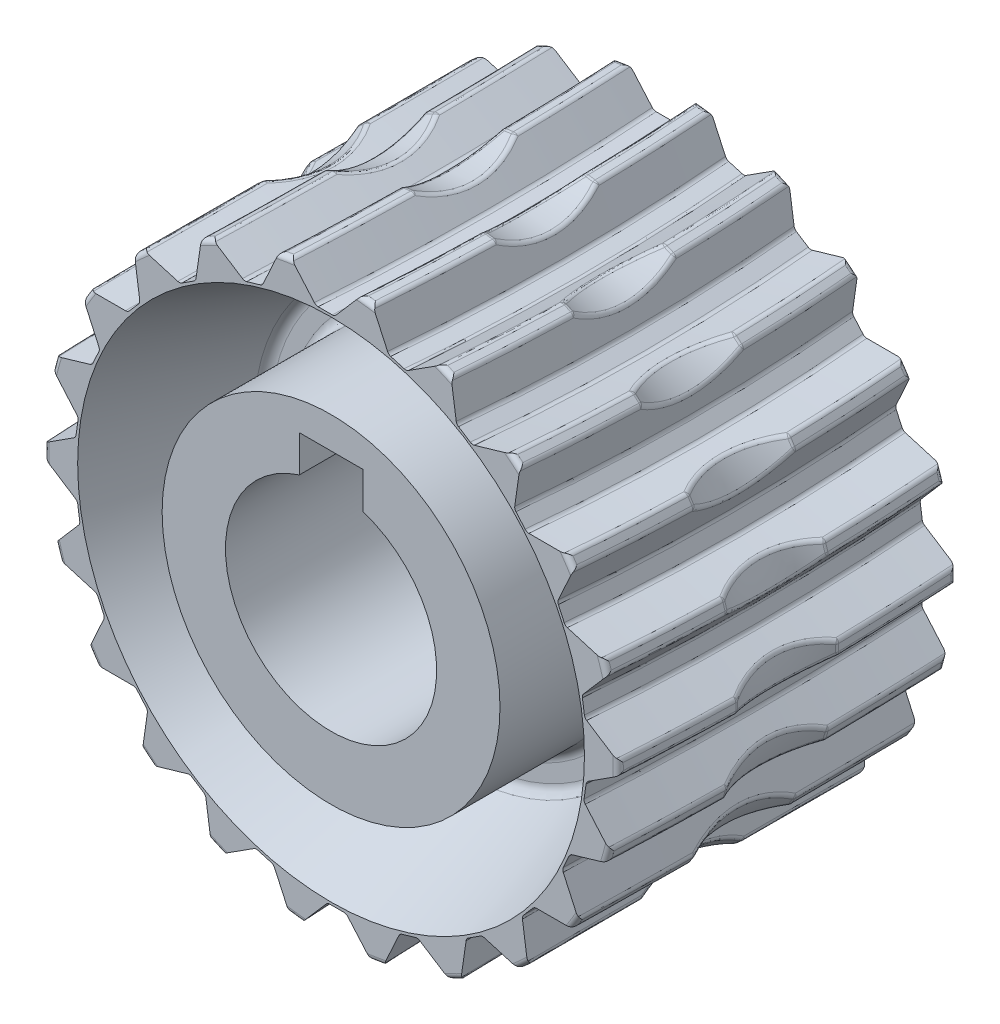
from build123d import *

# Parameters (mm, degrees)
SKETCH2_R                = 28.575
SKETCH2_R_2              = 7.9375
BOSS_EXTRUDE1_DEPTH      = 12.7
SKETCH3_R                = 7.9375
CHAMFER1_SIZE            = 2.54
FILLET1_R                = 0.7874
CUT_EXTRUDE1_DEPTH       = 43.359783404
CUT_EXTRUDE1_DEPTH_BACK  = 43.359783404
SKETCH5_W                = 4.7752
SKETCH5_H                = 10.3251
SKETCH9_W                = 25.4
SKETCH9_H                = 6.985
FILLET2_R                = 0.381
CIRPATTERN1_COUNT        = 22
FILLET2_OF_CIRPATTERN1_R = 0.381
FILLET3_R                = 0.381


with BuildPart() as part:
    # Sketch2 → Boss-Extrude1 (new, symmetric)
    with BuildSketch(Plane.XY):
        Circle(SKETCH2_R)
        Circle(SKETCH2_R_2, mode=Mode.SUBTRACT)
    extrude(amount=BOSS_EXTRUDE1_DEPTH, both=True)

    # Sketch3 → Cut-Revolve1 (revolve, cut)
    with BuildSketch(Plane(origin=(0, 0, 0), x_dir=(0, 0, -1), z_dir=(1, 0, 0))):
        with Locations((0, 28.575)):
            Circle(SKETCH3_R)
    revolve(axis=Axis((0, 0, 0), (0, 0, -1)), mode=Mode.SUBTRACT)

    # Sketch4 → Cut-Revolve2 (revolve, cut)
    with BuildSketch(Plane(origin=(0, 0, 0), x_dir=(0, 0, -1), z_dir=(1, 0, 0))):
        Polygon((12.7, 19.05), (2.54, 15.24), (2.54, 12.7), (12.7, 12.7), align=None)
        Polygon((-12.7, 12.7), (-12.7, 19.05), (-2.54, 15.24), (-2.54, 12.7), align=None)
    revolve(axis=Axis((0, 0, 0), (0, 0, -1)), mode=Mode.SUBTRACT)

    # Chamfer1
    chamfer1_edges = [part.edges().sort_by_distance(p)[0] for p in [
        (-28.575, 0, -12.7),
        (-28.575, 0, 12.7),
    ]]
    chamfer(chamfer1_edges, length=CHAMFER1_SIZE)

    # Fillet1
    fillet1_edges = [part.edges().sort_by_distance(p)[0] for p in [
        (0, -12.7, 2.54),
        (0, -12.7, -2.54),
        (0, -15.24, -2.54),
        (0, -15.24, 2.54),
    ]]
    fillet(fillet1_edges, radius=FILLET1_R)

    # Sketch5 → Cut-Extrude1 (cut, two sides: drawn at the far end of the back side and taken through both)
    with BuildSketch(Plane.XY.offset(-CUT_EXTRUDE1_DEPTH_BACK)):
        with Locations((0, 5.16255)):
            Rectangle(SKETCH5_W, SKETCH5_H)
    extrude(amount=CUT_EXTRUDE1_DEPTH + CUT_EXTRUDE1_DEPTH_BACK, mode=Mode.SUBTRACT)

    # Sketch9 → Cut-Revolve3 (revolve, cut)
    with BuildSketch(Plane(origin=(0, 0, 0), x_dir=(0, 0, -1), z_dir=(1, 0, 0))):
        with Locations((0, 25.0825)):
            Rectangle(SKETCH9_W, SKETCH9_H)
    revolve(axis=Axis((0, 0, -52.429787046), (0, 0, 1)), mode=Mode.SUBTRACT)

    # Cut-Sweep1: sweep along a path in Sketch7
    with BuildLine(Plane(origin=(0, 24.13, 0), x_dir=(1, 0, 0), z_dir=(0, 1, 0))) as cut_sweep1_path:
        ThreePointArc((-0.635, 15.24), (0, 0), (-0.635, -15.24))
    # Sketch12 → Cut-Sweep1 (sweep, cut)
    with BuildSketch(Plane(origin=(-0.635, 24.13, 15.24), x_dir=(0.9965337954939343, 0, 0.08318890814558023), z_dir=(-0.08318890814558023, 0, 0.9965337954939343))):
        Polygon((-0.6985, -4.9022), (0.6985, -4.9022), (4.950262732, 0), (-4.950262732, 0), align=None)
    cut_sweep1 = sweep(path=cut_sweep1_path.line, mode=Mode.SUBTRACT)

    # Fillet2
    fillet2_edges = [part.edges().sort_by_distance(p)[0] for p in [
        (-0.6985, 19.2278, 0),
        (0.6985, 19.2278, 0),
    ]]
    fillet(fillet2_edges, radius=FILLET2_R)

    # CirPattern1: Cut-Sweep1 ×22 about axis
    cirpattern1_axis = Axis((0, 0, -52.429787046), (0, 0, 1))
    for i in range(1, CIRPATTERN1_COUNT):
        add(cut_sweep1.rotate(cirpattern1_axis, i * 360 / CIRPATTERN1_COUNT), mode=Mode.SUBTRACT)

    # Fillet2 of CirPattern1
    fillet2_of_cirpattern1_edges = [part.edges().sort_by_distance(p)[0] for p in [
        (-6.087303099, 18.252148807, 0),
        (-4.746891414, 18.645729189, 0),
        (-10.982949103, 15.797817068, 0),
        (-9.807717917, 16.55309229, 0),
        (-14.988821888, 12.063640142, 0),
        (-14.073981443, 13.119422298, 0),
        (-17.780389467, 7.352138838, 0),
        (-17.200054694, 8.622894736, 0),
        (-19.131495635, 2.04501097, 0),
        (-18.932681806, 3.427791525, 0),
        (-18.932681806, -3.427791525, 0),
        (-19.131495635, -2.04501097, 0),
        (-17.200054694, -8.622894736, 0),
        (-17.780389467, -7.352138838, 0),
        (-14.073981443, -13.119422298, 0),
        (-14.988821888, -12.063640142, 0),
        (-9.807717917, -16.55309229, 0),
        (-10.982949103, -15.797817068, 0),
        (-4.746891414, -18.645729189, 0),
        (-6.087303099, -18.252148807, 0),
        (0.6985, -19.2278, 0),
        (-0.6985, -19.2278, 0),
        (6.087303099, -18.252148807, 0),
        (4.746891414, -18.645729189, 0),
        (10.982949103, -15.797817068, 0),
        (9.807717917, -16.55309229, 0),
        (14.988821888, -12.063640142, 0),
        (14.073981443, -13.119422298, 0),
        (17.780389467, -7.352138838, 0),
        (17.200054694, -8.622894736, 0),
        (19.131495635, -2.04501097, 0),
        (18.932681806, -3.427791525, 0),
        (18.932681806, 3.427791525, 0),
        (19.131495635, 2.04501097, 0),
        (17.200054694, 8.622894736, 0),
        (17.780389467, 7.352138838, 0),
        (14.073981443, 13.119422298, 0),
        (14.988821888, 12.063640142, 0),
        (9.807717917, 16.55309229, 0),
        (10.982949103, 15.797817068, 0),
        (4.746891414, 18.645729189, 0),
        (6.087303099, 18.252148807, 0),
    ]]
    fillet(fillet2_of_cirpattern1_edges, radius=FILLET2_OF_CIRPATTERN1_R)

    # Fillet3
    fillet3_edges = [part.edges().sort_by_distance(p)[0] for p in [
        (-14.611097653, 15.89477659, 8.237078233),
        (-14.61109766, 15.894776662, -8.237078232),
        (-14.439452275, 16.050866581, -12.7),
        (-13.913487952, 16.508874978, -8.237095845),
        (-13.913487999, 16.508874997, 8.237095846),
        (-18.497321584, 11.134504556, 8.237078233),
        (-18.497321611, 11.134504622, -8.237078232),
        (-18.376604682, 11.332629896, -12.7),
        (-18.000981487, 11.920267008, -8.237095845),
        (-18.000981537, 11.920267013, 8.237095846),
        (-20.885002528, 5.472181181, 8.237078233),
        (-20.885002573, 5.472181238, -8.237078232),
        (-20.824993868, 5.696290934, -12.7),
        (-20.630142557, 6.365949898, -8.237095845),
        (-20.630142606, 6.365949889, 8.237095846),
        (-21.580704775, -0.633465768, 8.237078233),
        (-21.580704834, -0.633465727, -8.237078232),
        (-21.586265901, -0.401527642, -12.7),
        (-21.58797217, 0.295901387, -8.237095845),
        (-21.587972214, 0.295901364, 8.237095846),
        (-20.528066667, -6.687793088, 8.237078233),
        (-20.528066735, -6.687793065, -8.237078232),
        (-20.59874705, -6.466816836, -12.7),
        (-20.796872666, -5.798119295, -8.237095845),
        (-20.796872702, -5.798119329, 8.237095846),
        (-19.465189627, -6.856588003, 0),
        (-20.705464522, -6.116521798, -3.770103613),
        (-20.082110884, -4.755547151, 0),
        (-20.705464522, -6.116521798, 3.770103613),
        (-20.59874705, -6.466816836, 12.7),
        (-20.608436746, -1.094870369, 0),
        (-21.58997105, -0.035356228, -3.770103613),
        (-20.608436746, 1.094870369, 0),
        (-21.58997105, -0.035356228, 3.770103613),
        (-21.586265901, -0.401527642, 12.7),
        (-20.082110884, 4.755547151, 0),
        (-20.725386524, 6.048673694, -3.770103613),
        (-19.465189627, 6.856588003, 0),
        (-20.725386524, 6.048673694, 3.770103613),
        (-20.824993868, 5.696290934, 12.7),
        (-17.92885183, 10.220698523, 0),
        (-18.18175444, 11.642676045, -3.770103613),
        (-16.744988608, 12.062825655, 0),
        (-18.18175444, 11.642676045, 3.770103613),
        (-18.376604682, 11.332629896, 12.7),
        (-14.323103828, 14.857829686, 0),
        (-14.165144742, 16.293458026, -3.770103613),
        (-12.668208198, 16.291804912, 0),
        (-14.165144742, 16.293458026, 3.770103613),
        (-14.439452275, 16.050866581, 12.7),
        (-9.541169485, 19.367348356, 8.237078233),
        (-9.541169472, 19.367348426, -8.237078232),
        (-9.33250132, 19.468757513, -12.7),
        (-8.698806371, 19.760032079, -8.237095845),
        (-8.69880641, 19.76003211, 8.237095846),
        (-9.556983137, 18.29126785, 0),
        (-9.000959261, 19.624240938, -3.770103613),
        (-7.565124901, 19.200919027, 0),
        (-9.000959261, 19.624240938, 3.770103613),
        (-9.33250132, 19.468757513, 12.7),
        (-17.812366683, -12.200315186, 8.237078233),
        (-17.812366754, -12.200315183, -8.237078232),
        (-18.320934247, -11.422410877, -8.237095846),
        (-18.320934247, -11.422410877, 8.237095846),
        (-17.942440218, -12.00820299, 12.7),
        (-18.143524399, -11.702163149, 3.770103613),
        (-16.744988608, -12.062825655, 0),
        (-17.92885183, -10.220698523, 0),
        (-17.942440218, -12.00820299, -12.7),
        (-18.143524399, -11.702163149, -3.770103613),
        (-13.653614684, -16.724440306, 8.237078233),
        (-13.653614754, -16.724440323, -8.237078232),
        (-14.360742659, -16.121326628, -8.237095846),
        (-14.360742659, -16.121326628, 8.237095846),
        (-13.832543587, -16.576755953, 12.7),
        (-14.111703833, -16.339764837, 3.770103613),
        (-12.668208198, -16.291804912, 0),
        (-14.323103828, -14.857829686, 0),
        (-13.832543587, -16.576755953, -12.7),
        (-14.111703833, -16.339764837, -3.770103613),
        (-8.388728024, -19.893650736, 8.237078233),
        (-8.388728086, -19.893650773, -8.237078232),
        (-8.60201654, -19.802358734, -12.7),
        (-9.237129106, -19.514188372, -8.237095846),
        (-9.237129106, -19.514188372, 8.237095846),
        (-7.565124901, -19.200919027, 0),
        (-8.936636948, -19.653615954, -3.770103613),
        (-9.556983137, -18.291267851, 0),
        (-8.936636948, -19.653615954, 3.770103613),
        (-8.60201654, -19.802358734, 12.7),
        (-2.44423651, -21.451195896, 8.237078233),
        (-2.444236559, -21.451195948, -8.237078232),
        (-3.365178289, -21.32612663, -8.237095846),
        (-3.365178289, -21.32612663, 8.237095846),
        (-2.674605271, -21.42369218, 12.7),
        (-3.037576886, -21.375247991, 3.770103613),
        (-1.849160176, -20.554488875, 0),
        (-4.016612509, -20.242856276, 0),
        (-2.674605271, -21.42369218, -12.7),
        (-3.037576886, -21.375247991, -3.770103613),
        (3.69827251, -21.270892739, 8.237078233),
        (3.698272477, -21.270892803, -8.237078232),
        (3.46948661, -21.309405498, -12.7),
        (2.77939926, -21.410348939, -8.237095846),
        (2.77939926, -21.410348939, 8.237095846),
        (4.01661251, -20.242856276, 0),
        (3.107569591, -21.365184559, -3.770103613),
        (1.849160176, -20.554488875, 0),
        (3.107569591, -21.365184559, 3.770103613),
        (3.46948661, -21.309405498, 12.7),
        (9.541169485, -19.367348356, 8.237078233),
        (9.541169472, -19.367348426, -8.237078232),
        (8.69880641, -19.76003211, -8.237095846),
        (8.69880641, -19.76003211, 8.237095846),
        (9.33250132, -19.468757513, 12.7),
        (9.000959261, -19.624240938, 3.770103613),
        (9.556983137, -18.29126785, 0),
        (7.565124901, -19.200919027, 0),
        (9.33250132, -19.468757513, -12.7),
        (9.000959261, -19.624240938, -3.770103613),
        (14.611097653, -15.89477659, 8.237078233),
        (14.61109766, -15.894776662, -8.237078232),
        (14.439452275, -16.050866581, -12.7),
        (13.913487999, -16.508874997, -8.237095846),
        (13.913487999, -16.508874997, 8.237095846),
        (14.323103828, -14.857829686, 0),
        (14.165144742, -16.293458026, -3.770103613),
        (12.668208198, -16.291804912, 0),
        (14.165144742, -16.293458026, 3.770103613),
        (14.439452275, -16.050866581, 12.7),
        (18.497321584, -11.134504556, 8.237078233),
        (18.497321611, -11.134504622, -8.237078232),
        (18.000981537, -11.920267013, -8.237095846),
        (18.000981537, -11.920267013, 8.237095846),
        (18.376604682, -11.332629896, 12.7),
        (18.376604682, -11.332629896, -12.7),
        (18.18175444, -11.642676045, 3.770103613),
        (17.92885183, -10.220698523, 0),
        (18.18175444, -11.642676045, -3.770103613),
        (16.744988608, -12.062825655, 0),
        (20.885002599, -5.472181272, 8.237078233),
        (20.885002599, -5.472181272, -8.237078233),
        (20.824993868, -5.696290934, -12.7),
        (20.630142606, -6.365949889, -8.237095846),
        (20.630142606, -6.365949889, 8.237095846),
        (20.082110884, -4.755547151, 0),
        (20.725386524, -6.048673694, -3.770103613),
        (19.465189627, -6.856588003, 0),
        (20.725386524, -6.048673694, 3.770103613),
        (20.824993868, -5.696290934, 12.7),
        (21.580704869, 0.633465701, 8.237078233),
        (21.580704869, 0.633465701, -8.237078233),
        (21.586265901, 0.401527642, -12.7),
        (21.587972214, -0.295901364, -8.237095846),
        (21.587972214, -0.295901364, 8.237095846),
        (21.586265901, 0.401527642, 12.7),
        (21.58997105, 0.035356228, 3.770103613),
        (20.608436746, 1.094870369, 0),
        (21.58997105, 0.035356228, -3.770103613),
        (20.608436746, -1.094870369, 0),
        (20.528066776, 6.68779305, 8.237078233),
        (20.528066776, 6.68779305, -8.237078233),
        (20.796872702, 5.798119329, -8.237095846),
        (20.796872702, 5.798119329, 8.237095846),
        (20.59874705, 6.466816836, 12.7),
        (20.59874705, 6.466816836, -12.7),
        (20.705464522, 6.116521798, 3.770103613),
        (19.465189627, 6.856588003, 0),
        (20.705464522, 6.116521798, -3.770103613),
        (20.082110884, 4.755547151, 0),
        (17.812366798, 12.20031518, 8.237078233),
        (17.812366798, 12.20031518, -8.237078233),
        (18.320934247, 11.422410877, -8.237095846),
        (18.320934247, 11.422410877, 8.237095846),
        (17.942440218, 12.00820299, 12.7),
        (18.143524399, 11.702163149, 3.770103613),
        (16.744988608, 12.062825655, 0),
        (17.92885183, 10.220698523, 0),
        (17.942440218, 12.00820299, -12.7),
        (18.143524399, 11.702163149, -3.770103613),
        (13.653614796, 16.724440332, 8.237078233),
        (13.653614796, 16.724440332, -8.237078233),
        (14.360742659, 16.121326628, -8.237095846),
        (14.360742659, 16.121326628, 8.237095846),
        (13.832543587, 16.576755953, 12.7),
        (14.111703833, 16.339764837, 3.770103613),
        (12.668208198, 16.291804912, 0),
        (14.323103828, 14.857829686, 0),
        (13.832543587, 16.576755953, -12.7),
        (14.111703833, 16.339764837, -3.770103613),
        (8.388728124, 19.893650793, 8.237078233),
        (8.388728124, 19.893650793, -8.237078233),
        (9.237129106, 19.514188372, -8.237095846),
        (9.237129106, 19.514188372, 8.237095846),
        (8.60201654, 19.802358734, 12.7),
        (8.936636948, 19.653615954, 3.770103613),
        (7.565124901, 19.200919027, 0),
        (9.556983137, 18.29126785, 0),
        (8.60201654, 19.802358734, -12.7),
        (8.936636948, 19.653615954, -3.770103613),
        (2.44423659, 21.451195979, 8.237078233),
        (3.365178289, 21.32612663, -8.237095846),
        (3.365178289, 21.32612663, 8.237095846),
        (2.674605271, 21.42369218, 12.7),
        (3.037576886, 21.375247991, 3.770103613),
        (1.849160176, 20.554488875, 0),
        (4.01661251, 20.242856276, 0),
        (2.44423659, 21.451195979, -8.237078233),
        (2.674605271, 21.42369218, -12.7),
        (3.037576886, 21.375247991, -3.770103613),
        (-2.77939926, 21.410348939, 8.237095846),
        (-3.46948661, 21.309405498, 12.7),
        (-3.69827251, 21.270892739, 8.237078233),
        (-3.698272477, 21.270892803, -8.237078232),
        (-1.849160176, 20.554488875, 0),
        (-3.107569591, 21.365184559, 3.770103613),
        (-4.01661251, 20.242856276, 0),
        (-2.779399231, 21.410348898, -8.237095845),
        (-3.107569591, 21.365184559, -3.770103613),
        (-3.46948661, 21.309405498, -12.7),
    ]]
    fillet(fillet3_edges, radius=FILLET3_R)


solid = part.part
